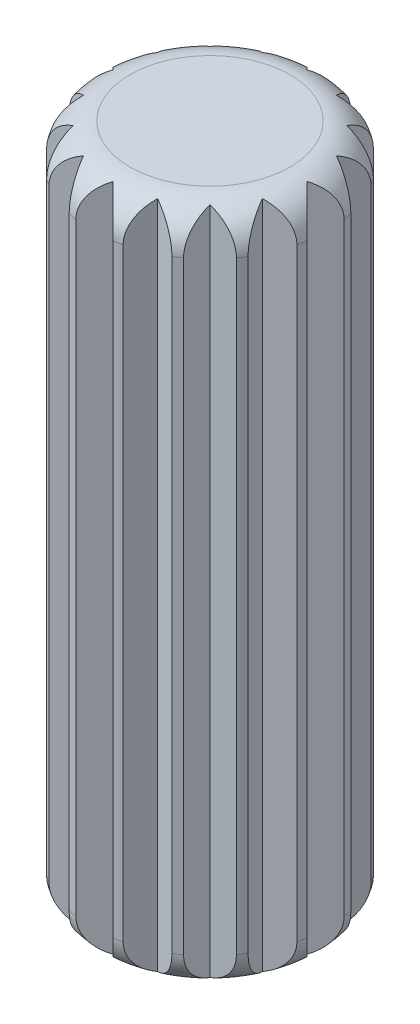
from build123d import *

# Parameters (mm, degrees)
SKETCH1_R           = 2.413
BOSS_EXTRUDE1_DEPTH = 13.97
FILLET2_R           = 0.762
CUT_EXTRUDE1_DEPTH  = 15.380752345


with BuildPart() as part:
    # Sketch1 → Boss-Extrude1 (new body)
    with BuildSketch(Plane(origin=(0, 0, 0), x_dir=(1, 0, 0), z_dir=(0, 1, 0))):
        with Locations(Location((0, 0, 0), (0, 0, 270))):
            Circle(SKETCH1_R)
    extrude(amount=BOSS_EXTRUDE1_DEPTH)

    # Fillet2
    fillet2_edges = [part.edges().sort_by_distance(p)[0] for p in [
        (0, 0, -2.413),
        (0, 13.97, -2.413),
    ]]
    fillet(fillet2_edges, radius=FILLET2_R)

    # Sketch2 → Cut-Extrude1 (cut, through all)
    with BuildSketch(Plane(origin=(0, 13.97, 0), x_dir=(1, 0, 0), z_dir=(0, 1, 0))):
        with BuildLine():
            Line((-0.385138848, 2.382065714), (0, 1.996926866))
            Line((0, 1.996926866), (0.385138848, 2.382065714))
            ThreePointArc((0.385138848, 2.382065714), (0, 2.413), (-0.385138848, 2.382065714))
        make_face()
        with BuildLine():
            Line((0.555755184, 2.348128015), (0.764190827, 1.844919859))
            Line((0.764190827, 1.844919859), (1.267398983, 2.053355502))
            ThreePointArc((1.267398983, 2.053355502), (0.923415122, 2.229321312), (0.555755184, 2.348128015))
        make_face()
        with BuildLine():
            Line((1.412040528, 1.956709111), (1.412040528, 1.412040528))
            Line((1.412040528, 1.412040528), (1.956709111, 1.412040528))
            ThreePointArc((1.956709111, 1.412040528), (1.706248663, 1.706248663), (1.412040528, 1.956709111))
        make_face()
        with BuildLine():
            Line((2.053355502, 1.267398983), (1.844919859, 0.764190827))
            Line((1.844919859, 0.764190827), (2.348128015, 0.555755184))
            ThreePointArc((2.348128015, 0.555755184), (2.229321312, 0.923415122), (2.053355502, 1.267398983))
        make_face()
        with BuildLine():
            Line((2.382065714, 0.385138848), (1.996926866, 0))
            Line((1.996926866, 0), (2.382065714, -0.385138848))
            ThreePointArc((2.382065714, -0.385138848), (2.413, 0), (2.382065714, 0.385138848))
        make_face()
        with BuildLine():
            Line((2.348128015, -0.555755184), (1.844919859, -0.764190827))
            Line((1.844919859, -0.764190827), (2.053355502, -1.267398983))
            ThreePointArc((2.053355502, -1.267398983), (2.229321312, -0.923415122), (2.348128015, -0.555755184))
        make_face()
        with BuildLine():
            Line((1.956709111, -1.412040528), (1.412040528, -1.412040528))
            Line((1.412040528, -1.412040528), (1.412040528, -1.956709111))
            ThreePointArc((1.412040528, -1.956709111), (1.706248663, -1.706248663), (1.956709111, -1.412040528))
        make_face()
        with BuildLine():
            Line((1.267398983, -2.053355502), (0.764190827, -1.844919859))
            Line((0.764190827, -1.844919859), (0.555755184, -2.348128015))
            ThreePointArc((0.555755184, -2.348128015), (0.923415122, -2.229321312), (1.267398983, -2.053355502))
        make_face()
        with BuildLine():
            Line((0.385138848, -2.382065714), (0, -1.996926866))
            Line((0, -1.996926866), (-0.385138848, -2.382065714))
            ThreePointArc((-0.385138848, -2.382065714), (0, -2.413), (0.385138848, -2.382065714))
        make_face()
        with BuildLine():
            Line((-0.555755184, -2.348128015), (-0.764190827, -1.844919859))
            Line((-0.764190827, -1.844919859), (-1.267398983, -2.053355502))
            ThreePointArc((-1.267398983, -2.053355502), (-0.923415122, -2.229321312), (-0.555755184, -2.348128015))
        make_face()
        with BuildLine():
            Line((-1.412040528, -1.956709111), (-1.412040528, -1.412040528))
            Line((-1.412040528, -1.412040528), (-1.956709111, -1.412040528))
            ThreePointArc((-1.956709111, -1.412040528), (-1.706248663, -1.706248663), (-1.412040528, -1.956709111))
        make_face()
        with BuildLine():
            Line((-2.053355502, -1.267398983), (-1.844919859, -0.764190827))
            Line((-1.844919859, -0.764190827), (-2.348128015, -0.555755184))
            ThreePointArc((-2.348128015, -0.555755184), (-2.229321312, -0.923415122), (-2.053355502, -1.267398983))
        make_face()
        with BuildLine():
            Line((-2.382065714, -0.385138848), (-1.996926866, 0))
            Line((-1.996926866, 0), (-2.382065714, 0.385138848))
            ThreePointArc((-2.382065714, 0.385138848), (-2.413, 0), (-2.382065714, -0.385138848))
        make_face()
        with BuildLine():
            Line((-2.348128015, 0.555755184), (-1.844919859, 0.764190827))
            Line((-1.844919859, 0.764190827), (-2.053355502, 1.267398983))
            ThreePointArc((-2.053355502, 1.267398983), (-2.229321312, 0.923415122), (-2.348128015, 0.555755184))
        make_face()
        with BuildLine():
            Line((-1.956709111, 1.412040528), (-1.412040528, 1.412040528))
            Line((-1.412040528, 1.412040528), (-1.412040528, 1.956709111))
            ThreePointArc((-1.412040528, 1.956709111), (-1.706248663, 1.706248663), (-1.956709111, 1.412040528))
        make_face()
        with BuildLine():
            Line((-1.267398983, 2.053355502), (-0.764190827, 1.844919859))
            Line((-0.764190827, 1.844919859), (-0.555755184, 2.348128015))
            ThreePointArc((-0.555755184, 2.348128015), (-0.923415122, 2.229321312), (-1.267398983, 2.053355502))
        make_face()
    extrude(amount=-CUT_EXTRUDE1_DEPTH, mode=Mode.SUBTRACT)


solid = part.part
